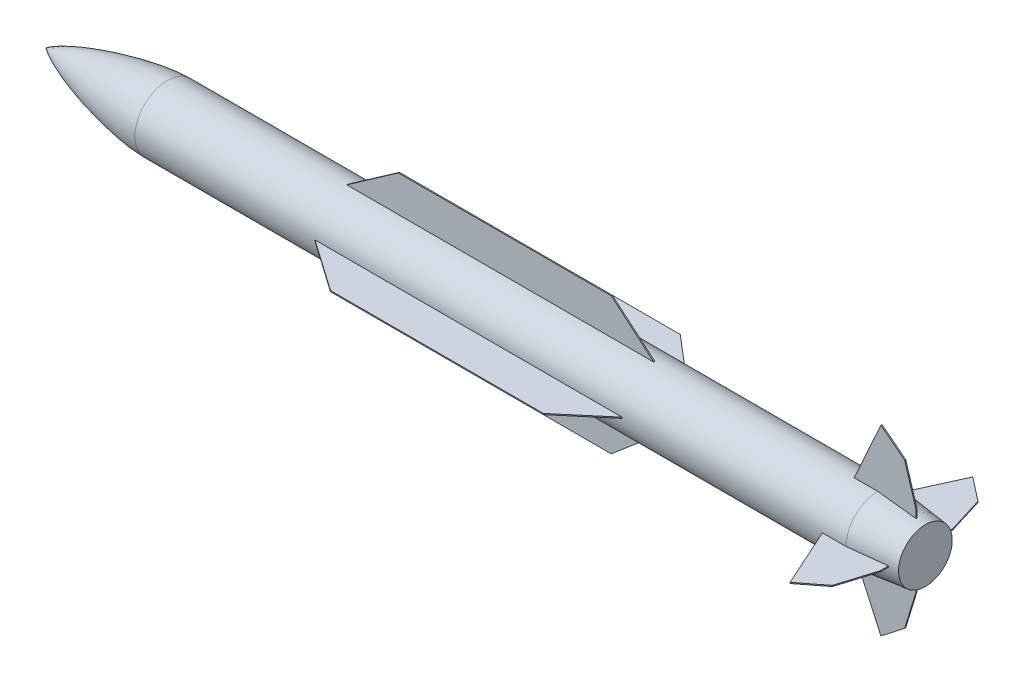
from build123d import *

# Parameters (mm, degrees)
BOSS_EXTRUDE1_DEPTH   = 0.545404963
BOSS_EXTRUDE1_2_DEPTH = 0.545404963
SCALE2_SCALE          = 5.287
CIRPATTERN1_START     = 378.196965722
CIRPATTERN1_DEPTH     = 5.767112081
CIRPATTERN1_START_2   = -2.88355604
CIRPATTERN1_2_DEPTH   = 5.76711208


with BuildPart() as part:
    # Sketch1 → Revolve1 (revolve)
    with BuildSketch(Plane.XY, mode=Mode.PRIVATE) as revolve1_sk:
        with BuildLine():
            Line((152.219440928, 104.949962647), (874.703810113, 104.949962647))
            Line((874.703810113, 104.949962647), (922.610904161, 99.360176626))
            Line((922.610904161, 99.360176626), (922.610904161, 72.078782251))
            Line((922.610904161, 72.078782251), (29.011489455, 72.078782251))
            add(Edge.make_bspline(
                [(29.011489455, 72.078782251), (71.639201594, 104.949962647), (152.219440928, 104.949962647)],
                knots=[0, 0, 0, 1, 1, 1], degree=2, weights=[1, 0.474859473, 1]))
        make_face()
    revolve(revolve1_sk.sketch.rotate(Axis((29.011489455, 72.078782251, 0), (1, 0, 0)), 90), axis=Axis((29.011489455, 72.078782251, 0), (1, 0, 0)))


with BuildPart() as body_2:
    # Sketch2 → Boss-Extrude1 (new, symmetric)
    with BuildSketch(Plane.XY):
        Polygon((850.176909973, 50.048019845), (913.4933382, 50.048019845), (913.4933382, 35.352717878), (902.078807117, -1.899656367), (877.941925748, -20.703868936), (850.176909973, 40.632503532), align=None)
    extrude(amount=BOSS_EXTRUDE1_DEPTH, both=True)


with BuildPart() as body_3:
    # Sketch2 → Boss-Extrude1 2 (new, symmetric)
    with BuildSketch(Plane.XY):
        Polygon((333.188164698, 40.632503532), (387.630174448, 2.549802235), (603.927645349, 2.549802235), (648.816726438, 40.632503532), (648.816726438, 50.048019845), (333.188164698, 50.048019845), align=None)
    extrude(amount=BOSS_EXTRUDE1_2_DEPTH, both=True)


with BuildPart() as part_1:
    # Scale2: scaled about (0, 0, 0)
    add(part.part.scale(SCALE2_SCALE))

    # CirPattern1: read off the stored shape, not the designer's step
    # CirPattern1 outline → CirPattern1 (add)
    with BuildSketch(Plane(origin=(0, 0, 0), x_dir=(1, 0, 0), z_dir=(0, 1, 0)).offset(CIRPATTERN1_START)):
        Polygon((4419.626329355, 0), (4641.678961432, -490.541876827), (4769.290653226, -391.124004973), (4829.639279064, -194.170702341), (4829.639279064, 194.170702341), (4769.290653226, 391.124004973), (4641.678961432, 490.541876827), align=None)
        Polygon((3192.965460961, -367.599717344), (3626.264910808, 0), (3192.965460961, 367.599717344), (2049.400732307, 367.599717344), (1772.301251505, 173.766006848), (1771, 172.8557691), (1771, -172.8557691), (1772.301251505, -173.766006848), (2049.400732307, -367.599717344), align=None)
    extrude(amount=CIRPATTERN1_DEPTH)

    # CirPattern1 2 outline → CirPattern1 2 (add)
    with BuildSketch(Plane.XY.offset(CIRPATTERN1_START_2)):
        Polygon((4829.639279064, 377), (4829.639279064, 575.251224103), (4769.290653226, 772.204526736), (4641.678961432, 871.62239859), (4417.779207548, 377), align=None)
        Polygon((1771, 377), (3631.074729074, 377), (3192.965460961, 748.680239107), (2049.400732307, 748.680239107), (1772.301251505, 554.846528611), (1771, 553.936290863), align=None)
    extrude(amount=CIRPATTERN1_2_DEPTH)


with BuildPart() as body_3_1:
    # Scale2: scaled about (0, 0, 0)
    add(body_3.part.scale(SCALE2_SCALE))


with BuildPart() as body_2_1:
    # Scale2: scaled about (0, 0, 0)
    add(body_2.part.scale(SCALE2_SCALE))


with BuildPart() as part_2:
    add(part_1.part)

    # Combine1: union body 3, body 2
    add(body_3_1.part)
    add(body_2_1.part)


with BuildPart() as part_3:
    # Body-Move/Copy1: read off the stored shape, not the designer's step
    # Body-Move/Copy1: moved
    add(part_2.part.moved(Location((-153.3837447, -381.0805218, 0))))


solid = part_3.part
